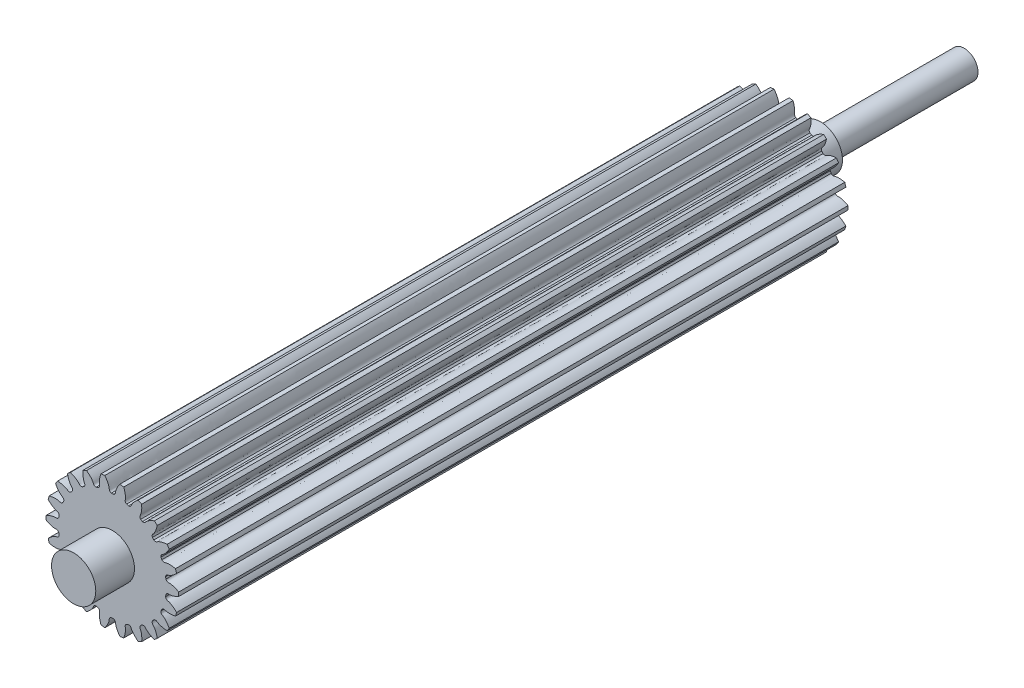
from build123d import *
from build123d.topology import SkipClean

# Parameters (mm, degrees)
SKETCH_1_R               = 12
EXTRUDE_1_DEPTH          = 30
CUT_EXTRUDE_1_DEPTH      = 35.467375879
PATTERN_CIRCULAR_1_COUNT = 22
EXTRUDE_START            = 91
EXTRUDE_2_DEPTH          = 91
SKETCH_19_R              = 4
EXTRUDE_3_DEPTH          = 7
EXTRUDE_START_2          = 7
SKETCH_20_R              = 4
EXTRUDE_4_DEPTH          = 7
SKETCH_21_R              = 2.5
EXTRUDE_5_DEPTH          = 26


with BuildPart() as part:
    # 草图1 → 凸台-拉伸1 (new body)
    with BuildSketch(Plane.XY):
        Circle(SKETCH_1_R)
    extrude(amount=EXTRUDE_1_DEPTH)

    # 草图2 → 切除-拉伸1 (cut, through all)
    with BuildSketch(Plane.XY):
        with BuildLine():
            ThreePointArc((0.185665431, 9.748232063), (0, 9.75), (-0.185665431, 9.748232063))
            add(Edge.make_bspline(
                [(-0.185665431, 9.748232063), (-0.588158706, 9.876186429), (-0.548347264, 10.151774696), (-0.599584047, 10.42157039), (-0.60596118, 10.451918903), (-0.613876897, 10.486162213), (-0.623483721, 10.524250431), (-0.634939934, 10.566127653), (-0.648399943, 10.611733662), (-0.664017171, 10.661003439), (-0.681942991, 10.713867378), (-0.70232689, 10.77025128), (-0.72531626, 10.830076418), (-0.751056303, 10.893259589), (-0.779689902, 10.959713172), (-0.811357505, 11.029345185), (-0.846197011, 11.10205935), (-0.884343649, 11.177755162), (-0.925929868, 11.25632795), (-0.971085225, 11.337668957), (-1.019936271, 11.421665408), (-1.072606448, 11.508200591), (-1.129215979, 11.597153935), (-1.189881763, 11.688401095), (-1.254717274, 11.781814033), (-1.323832459, 11.877261111), (-1.397333644, 11.974607178), (-1.475323431, 12.073713662), (-1.557900608, 12.174438668), (-1.64516006, 12.276637076), (-1.737192673, 12.380160638), (-1.834085256, 12.484858081), (-1.935920447, 12.590575215), (-2.042776642, 12.697155033), (-2.154727905, 12.804437827), (-2.271843904, 12.912261294), (-2.394189822, 13.020460649), (-2.521826308, 13.128868741), (-2.654809363, 13.237316171), (-2.841488127, 13.383435539), (-2.986445715, 13.489968103), (-3.085558798, 13.559868128)],
                knots=[0, 0, 0, 0, 0.157021319, 0.162530984, 0.168888289, 0.176093235, 0.184145822, 0.19304605, 0.202793918, 0.213389427, 0.224832576, 0.237123367, 0.250261798, 0.264247869, 0.279081582, 0.294762935, 0.311291928, 0.328668563, 0.346892838, 0.365964754, 0.38588431, 0.406651508, 0.428266346, 0.450728824, 0.474038944, 0.498196704, 0.523202104, 0.549055146, 0.575755828, 0.603304151, 0.631700114, 0.660943719, 0.691034964, 0.721973849, 0.753760376, 0.786394543, 0.819876351, 0.854205799, 0.889382888, 0.925407618, 1, 1, 1, 1], degree=3))
            ThreePointArc((-3.085558798, 13.559868128), (0, 13.906498364), (3.085558798, 13.559868128))
            add(Edge.make_bspline(
                [(0.185665431, 9.748232063), (0.588158706, 9.876186429), (0.548347264, 10.151774696), (0.599584047, 10.42157039), (0.60596118, 10.451918903), (0.613876897, 10.486162213), (0.623483721, 10.524250431), (0.634939934, 10.566127653), (0.648399943, 10.611733662), (0.664017171, 10.661003439), (0.681942991, 10.713867378), (0.70232689, 10.77025128), (0.72531626, 10.830076418), (0.751056303, 10.893259589), (0.779689902, 10.959713172), (0.811357505, 11.029345185), (0.846197011, 11.10205935), (0.884343649, 11.177755162), (0.925929868, 11.25632795), (0.971085225, 11.337668957), (1.019936271, 11.421665408), (1.072606448, 11.508200591), (1.129215979, 11.597153935), (1.189881763, 11.688401095), (1.254717274, 11.781814033), (1.323832459, 11.877261111), (1.397333644, 11.974607178), (1.475323431, 12.073713662), (1.557900608, 12.174438668), (1.64516006, 12.276637076), (1.737192673, 12.380160638), (1.834085256, 12.484858081), (1.935920447, 12.590575215), (2.042776642, 12.697155033), (2.154727905, 12.804437827), (2.271843904, 12.912261294), (2.394189822, 13.020460649), (2.521826308, 13.128868741), (2.654809363, 13.237316171), (2.841488127, 13.383435539), (2.986445715, 13.489968103), (3.085558798, 13.559868128)],
                knots=[0, 0, 0, 0, 0.157021319, 0.162530984, 0.168888289, 0.176093235, 0.184145822, 0.19304605, 0.202793918, 0.213389427, 0.224832576, 0.237123367, 0.250261798, 0.264247869, 0.279081582, 0.294762935, 0.311291928, 0.328668563, 0.346892838, 0.365964754, 0.38588431, 0.406651508, 0.428266346, 0.450728824, 0.474038944, 0.498196704, 0.523202104, 0.549055146, 0.575755828, 0.603304151, 0.631700114, 0.660943719, 0.691034964, 0.721973849, 0.753760376, 0.786394543, 0.819876351, 0.854205799, 0.889382888, 0.925407618, 1, 1, 1, 1], degree=3))
        make_face()
    cut_extrude_1 = extrude(amount=CUT_EXTRUDE_1_DEPTH, mode=Mode.SUBTRACT)

    # 阵列(圆周)1: 切除-拉伸1 ×22 about axis
    pattern_circular_1_axis = Axis((0, 0, -1.5), (0, 0, 1))
    for i in range(1, PATTERN_CIRCULAR_1_COUNT):
        add(cut_extrude_1.rotate(pattern_circular_1_axis, i * 360 / PATTERN_CIRCULAR_1_COUNT), mode=Mode.SUBTRACT)

    # 草图4 → 凸台-拉伸2 (add)
    with BuildSketch(Plane(origin=(0, 0, 0), x_dir=(-1, 0, 0), z_dir=(0, 0, -1)).offset(EXTRUDE_START)):
        with BuildLine():
            ThreePointArc((2.924539021, 9.301052173), (2.746892429, 9.355056493), (2.568249667, 9.405668166))
            add(Edge.make_bspline(
                [(2.568249667, 9.405668166), (2.218109108, 9.641834941), (2.333950094, 9.895043767), (2.361944393, 10.180005258), (2.365849304, 10.238460497), (2.368085913, 10.32113962), (2.366834845, 10.420382901), (2.360772595, 10.536017252), (2.34858845, 10.667790208), (2.32898426, 10.815370787), (2.300679804, 10.978350119), (2.26241667, 11.156242389), (2.212962422, 11.348485973), (2.151114634, 11.554444777), (2.096274933, 11.713680077), (2.062581682, 11.80433527), (2.055688884, 11.822611522)],
                knots=[0, 0, 0, 0, 0.157021319, 0.162530984, 0.176093235, 0.19304605, 0.213389427, 0.237123367, 0.264247869, 0.294762935, 0.328668563, 0.365964754, 0.406651508, 0.450728824, 0.498196704, 0.510209942, 0.510209942, 0.510209942, 0.510209942], degree=3))
            ThreePointArc((2.055688884, 11.822611522), (1.707778059, 11.877857303), (1.358395532, 11.922867171))
            add(Edge.make_bspline(
                [(1.358395532, 11.922867171), (1.300155371, 11.845656586), (1.201946581, 11.708817962), (1.073915974, 11.512256119), (0.972303664, 11.341732625), (0.885472389, 11.181826213), (0.812397844, 11.033422979), (0.752009469, 10.897343589), (0.703194045, 10.774341044), (0.670055832, 10.680054419), (0.644027119, 10.597938124), (0.627360159, 10.539619361), (0.611348785, 10.476138997), (0.60176986, 10.433080149), (0.548347264, 10.151774696), (0.588158706, 9.876186429), (0.185665431, 9.748232063)],
                knots=[0.489790058, 0.489790058, 0.489790058, 0.489790058, 0.549271176, 0.593348492, 0.634035246, 0.671331437, 0.705237065, 0.735752131, 0.762876633, 0.786610573, 0.797206082, 0.815854178, 0.823906765, 0.837469016, 0.842978681, 1, 1, 1, 1], degree=3))
            ThreePointArc((0.185665431, 9.748232063), (0, 9.75), (-0.185665431, 9.748232063))
            add(Edge.make_bspline(
                [(-0.185665431, 9.748232063), (-0.588158706, 9.876186429), (-0.548347264, 10.151774696), (-0.60176986, 10.433080149), (-0.61449187, 10.490267681), (-0.635639261, 10.570227844), (-0.664799714, 10.665098608), (-0.703194362, 10.774341023), (-0.752009695, 10.897343577), (-0.812398032, 11.033422968), (-0.885472542, 11.181826205), (-0.972303795, 11.341732617), (-1.073916075, 11.512256114), (-1.191283893, 11.692447604), (-1.288763969, 11.829782626), (-1.346632927, 11.907273161), (-1.358395532, 11.922867171)],
                knots=[0, 0, 0, 0, 0.157021319, 0.162530984, 0.176093235, 0.19304605, 0.213389427, 0.237123367, 0.264247869, 0.294762935, 0.328668563, 0.365964754, 0.406651508, 0.450728824, 0.498196704, 0.510209942, 0.510209942, 0.510209942, 0.510209942], degree=3))
            ThreePointArc((-1.358395532, 11.922867171), (-1.707778059, 11.877857303), (-2.055688884, 11.822611522))
            add(Edge.make_bspline(
                [(-2.055688884, 11.822611522), (-2.089817174, 11.732120359), (-2.145495923, 11.573156047), (-2.21296252, 11.34848595), (-2.262416797, 11.156242359), (-2.300679954, 10.978350084), (-2.328984444, 10.815370745), (-2.348588671, 10.667790156), (-2.360772906, 10.536017183), (-2.366005176, 10.436213716), (-2.36784471, 10.350090571), (-2.367406247, 10.289438503), (-2.364884562, 10.224018615), (-2.361944393, 10.180005258), (-2.333950094, 9.895043767), (-2.218109108, 9.641834941), (-2.568249667, 9.405668166)],
                knots=[0.489790058, 0.489790058, 0.489790058, 0.489790058, 0.549271176, 0.593348492, 0.634035246, 0.671331437, 0.705237065, 0.735752131, 0.762876633, 0.786610573, 0.797206082, 0.815854178, 0.823906765, 0.837469016, 0.842978681, 1, 1, 1, 1], degree=3))
            ThreePointArc((-2.568249667, 9.405668166), (-2.746892429, 9.355056493), (-2.924539021, 9.301052173))
            add(Edge.make_bspline(
                [(-2.924539021, 9.301052173), (-3.3467774, 9.310428028), (-3.386220788, 9.586069213), (-3.516732299, 9.840928935), (-3.545050567, 9.892215766), (-3.587868721, 9.962979072), (-3.642576155, 10.045791454), (-3.710192695, 10.139791761), (-3.791684488, 10.244058979), (-3.887964667, 10.357612838), (-3.999889169, 10.479417233), (-4.128253989, 10.608383121), (-4.273792278, 10.74337173), (-4.437171685, 10.883197863), (-4.569394878, 10.987506541), (-4.646751344, 11.045554595), (-4.662430821, 11.057203029)],
                knots=[0, 0, 0, 0, 0.157021319, 0.162530984, 0.176093235, 0.19304605, 0.213389427, 0.237123367, 0.264247869, 0.294762935, 0.328668563, 0.365964754, 0.406651508, 0.450728824, 0.498196704, 0.510209942, 0.510209942, 0.510209942, 0.510209942], degree=3))
            ThreePointArc((-4.662430821, 11.057203029), (-4.984980156, 10.915583944), (-5.303233613, 10.7645582))
            add(Edge.make_bspline(
                [(-5.303233613, 10.7645582), (-5.310485161, 10.668117515), (-5.319123107, 10.499905858), (-5.320559952, 10.265328941), (-5.313849705, 10.066939687), (-5.300444889, 9.885473322), (-5.281686262, 9.721121495), (-5.258918124, 9.573995807), (-5.233484075, 9.44412787), (-5.210386516, 9.346893044), (-5.187887842, 9.263740235), (-5.170379477, 9.205668531), (-5.149529026, 9.143609049), (-5.134307959, 9.102206883), (-5.027164697, 8.83667524), (-4.844678915, 8.626359328), (-5.114100451, 8.301112972)],
                knots=[0.489790058, 0.489790058, 0.489790058, 0.489790058, 0.549271176, 0.593348492, 0.634035246, 0.671331437, 0.705237065, 0.735752131, 0.762876633, 0.786610573, 0.797206082, 0.815854178, 0.823906765, 0.837469016, 0.842978681, 1, 1, 1, 1], degree=3))
            ThreePointArc((-5.114100451, 8.301112972), (-5.27124797, 8.202221945), (-5.426483851, 8.100356351))
            add(Edge.make_bspline(
                [(-5.426483851, 8.100356351), (-5.834260094, 7.99039412), (-5.949762843, 8.243757414), (-6.146790001, 8.451524185), (-6.188410351, 8.49275536), (-6.249430396, 8.548588987), (-6.325252738, 8.612634021), (-6.41661328, 8.683776874), (-6.524179553, 8.760861647), (-6.648551527, 8.842690515), (-6.790258564, 8.928028199), (-6.949757596, 9.015605514), (-7.127431248, 9.104123262), (-7.323586215, 9.192256156), (-7.479840591, 9.255088021), (-7.570417602, 9.288990887), (-7.588743694, 9.295750058)],
                knots=[0, 0, 0, 0, 0.157021319, 0.162530984, 0.176093235, 0.19304605, 0.213389427, 0.237123367, 0.264247869, 0.294762935, 0.328668563, 0.365964754, 0.406651508, 0.450728824, 0.498196704, 0.510209942, 0.510209942, 0.510209942, 0.510209942], degree=3))
            ThreePointArc((-7.588743694, 9.295750058), (-7.858328807, 9.068994892), (-8.121141894, 8.834424392))
            add(Edge.make_bspline(
                [(-8.121141894, 8.834424392), (-8.100929222, 8.739847235), (-8.061826571, 8.576015742), (-7.997117259, 8.350536032), (-7.934786112, 8.162073431), (-7.870799303, 7.991734302), (-7.806497272, 7.839324794), (-7.743201307, 7.704573257), (-7.68220949, 7.587131484), (-7.632653327, 7.500342686), (-7.587639155, 7.426896759), (-7.554479312, 7.376110043), (-7.516989274, 7.322438657), (-7.49072043, 7.287001839), (-7.313108313, 7.06241184), (-7.078761648, 6.912027385), (-7.245637231, 6.524050974)],
                knots=[0.489790058, 0.489790058, 0.489790058, 0.489790058, 0.549271176, 0.593348492, 0.634035246, 0.671331437, 0.705237065, 0.735752131, 0.762876633, 0.786610573, 0.797206082, 0.815854178, 0.823906765, 0.837469016, 0.842978681, 1, 1, 1, 1], degree=3))
            ThreePointArc((-7.245637231, 6.524050974), (-7.36855835, 6.384892156), (-7.488807233, 6.243417832))
            add(Edge.make_bspline(
                [(-7.488807233, 6.243417832), (-7.849085732, 6.023026001), (-8.031290497, 6.233585417), (-8.278871334, 6.377427208), (-8.330421932, 6.405262424), (-8.404700387, 6.441643063), (-8.495494963, 6.481732201), (-8.603198018, 6.52425403), (-8.728124391, 6.567911406), (-8.870512283, 6.611385996), (-9.030521594, 6.653343419), (-9.208233175, 6.692437167), (-9.403648127, 6.727312872), (-9.616687345, 6.756612524), (-9.784314102, 6.772877312), (-9.88077365, 6.77988838), (-9.900261685, 6.781210701)],
                knots=[0, 0, 0, 0, 0.157021319, 0.162530984, 0.176093235, 0.19304605, 0.213389427, 0.237123367, 0.264247869, 0.294762935, 0.328668563, 0.365964754, 0.406651508, 0.450728824, 0.498196704, 0.510209942, 0.510209942, 0.510209942, 0.510209942], degree=3))
            ThreePointArc((-9.900261685, 6.781210701), (-10.095042394, 6.487689809), (-10.281123557, 6.188578059))
            add(Edge.make_bspline(
                [(-10.281123557, 6.188578059), (-10.235084176, 6.103526509), (-10.151408791, 5.957347833), (-10.025795686, 5.759232356), (-9.912893339, 5.595964528), (-9.803508366, 5.450552498), (-9.698872299, 5.322432622), (-9.60017637, 5.210972003), (-9.508567979, 5.115470827), (-9.43656796, 5.046159169), (-9.372685068, 4.988370276), (-9.326560161, 4.948982987), (-9.275467756, 4.908047833), (-9.240279279, 4.881447244), (-9.006587387, 4.715993833), (-8.739365211, 4.637724091), (-8.790175575, 4.218449166)],
                knots=[0.489790058, 0.489790058, 0.489790058, 0.489790058, 0.549271176, 0.593348492, 0.634035246, 0.671331437, 0.705237065, 0.735752131, 0.762876633, 0.786610573, 0.797206082, 0.815854178, 0.823906765, 0.837469016, 0.842978681, 1, 1, 1, 1], degree=3))
            ThreePointArc((-8.790175575, 4.218449166), (-8.868911955, 4.050296377), (-8.94443199, 3.880674732))
            add(Edge.make_bspline(
                [(-8.94443199, 3.880674732), (-9.228025124, 3.567708136), (-9.462170759, 3.718405401), (-9.740247748, 3.786669007), (-9.797552271, 3.798853219), (-9.879071537, 3.812833528), (-9.97748271, 3.825718986), (-10.092802818, 3.836174925), (-10.2249685, 3.842868044), (-10.373836889, 3.844466303), (-10.53918547, 3.839644323), (-10.720712465, 3.827087362), (-10.91803736, 3.805495601), (-11.130701659, 3.773588328), (-11.296120675, 3.741968363), (-11.390648179, 3.721519639), (-11.409719353, 3.717297982)],
                knots=[0, 0, 0, 0, 0.157021319, 0.162530984, 0.176093235, 0.19304605, 0.213389427, 0.237123367, 0.264247869, 0.294762935, 0.328668563, 0.365964754, 0.406651508, 0.450728824, 0.498196704, 0.510209942, 0.510209942, 0.510209942, 0.510209942], degree=3))
            ThreePointArc((-11.409719353, 3.717297982), (-11.513915683, 3.380790682), (-11.608189734, 3.041369937))
            add(Edge.make_bspline(
                [(-11.608189734, 3.041369937), (-11.540053481, 2.972734366), (-11.418584245, 2.856051033), (-11.242243773, 2.701349926), (-11.087916901, 2.576503859), (-10.941995486, 2.467799346), (-10.805502374, 2.374348612), (-10.679402238, 2.295208787), (-10.564598841, 2.229385146), (-10.475987977, 2.183165848), (-10.398411779, 2.145715701), (-10.343058573, 2.120918762), (-10.282503004, 2.096036163), (-10.241245656, 2.080426825), (-9.970406315, 1.987514054), (-9.69195738, 1.987699973), (-9.62258617, 1.571093695)],
                knots=[0.489790058, 0.489790058, 0.489790058, 0.489790058, 0.549271176, 0.593348492, 0.634035246, 0.671331437, 0.705237065, 0.735752131, 0.762876633, 0.786610573, 0.797206082, 0.815854178, 0.823906765, 0.837469016, 0.842978681, 1, 1, 1, 1], degree=3))
            ThreePointArc((-9.62258617, 1.571093695), (-9.650759058, 1.387569673), (-9.675432062, 1.203542444))
            add(Edge.make_bspline(
                [(-9.675432062, 1.203542444), (-9.859364802, 0.823355776), (-10.126482219, 0.901982294), (-10.412527217, 0.889137403), (-10.470943193, 0.88468352), (-10.553099064, 0.875130897), (-10.651154146, 0.859768772), (-10.764748758, 0.837311742), (-10.893446471, 0.806498368), (-11.036734926, 0.766090814), (-11.194027219, 0.71488008), (-11.36466339, 0.651689699), (-11.547912138, 0.575379709), (-11.742972721, 0.484850449), (-11.892782731, 0.407907392), (-11.977720136, 0.361655509), (-11.994829415, 0.352231889)],
                knots=[0, 0, 0, 0, 0.157021319, 0.162530984, 0.176093235, 0.19304605, 0.213389427, 0.237123367, 0.264247869, 0.294762935, 0.328668563, 0.365964754, 0.406651508, 0.450728824, 0.498196704, 0.510209942, 0.510209942, 0.510209942, 0.510209942], degree=3))
            ThreePointArc((-11.994829415, 0.352231889), (-12, 0), (-11.994829415, -0.352231889))
            add(Edge.make_bspline(
                [(-11.994829415, -0.352231889), (-11.910116284, -0.398891037), (-11.760693911, -0.476626036), (-11.547912129, -0.57537981), (-11.364663379, -0.651689829), (-11.194027205, -0.714880233), (-11.03673491, -0.766091002), (-10.89344645, -0.806498594), (-10.764748734, -0.83731206), (-10.666705752, -0.856694587), (-10.58172101, -0.870771999), (-10.521623893, -0.878969688), (-10.456511011, -0.885783891), (-10.412527217, -0.889137403), (-10.126482219, -0.901982294), (-9.859364802, -0.823355776), (-9.675432062, -1.203542444)],
                knots=[0.489790058, 0.489790058, 0.489790058, 0.489790058, 0.549271176, 0.593348492, 0.634035246, 0.671331437, 0.705237065, 0.735752131, 0.762876633, 0.786610573, 0.797206082, 0.815854178, 0.823906765, 0.837469016, 0.842978681, 1, 1, 1, 1], degree=3))
            ThreePointArc((-9.675432062, -1.203542444), (-9.650759058, -1.387569673), (-9.62258617, -1.571093695))
            add(Edge.make_bspline(
                [(-9.62258617, -1.571093695), (-9.69195738, -1.987699973), (-9.970406315, -1.987514054), (-10.241245656, -2.080426825), (-10.296040571, -2.101157977), (-10.372177267, -2.133469636), (-10.461932418, -2.175834796), (-10.564598775, -2.229385458), (-10.679402194, -2.29520901), (-10.805502337, -2.374348797), (-10.941995455, -2.467799496), (-11.087916875, -2.576503987), (-11.242243753, -2.701350024), (-11.403897972, -2.843167131), (-11.52596226, -2.959199811), (-11.594428442, -3.027507799), (-11.608189734, -3.041369937)],
                knots=[0, 0, 0, 0, 0.157021319, 0.162530984, 0.176093235, 0.19304605, 0.213389427, 0.237123367, 0.264247869, 0.294762935, 0.328668563, 0.365964754, 0.406651508, 0.450728824, 0.498196704, 0.510209942, 0.510209942, 0.510209942, 0.510209942], degree=3))
            ThreePointArc((-11.608189734, -3.041369937), (-11.513915683, -3.380790682), (-11.409719353, -3.717297982))
            add(Edge.make_bspline(
                [(-11.409719353, -3.717297982), (-11.315292297, -3.73820066), (-11.150022101, -3.770689699), (-10.918037323, -3.805495695), (-10.720712418, -3.827087483), (-10.539185414, -3.839644466), (-10.373836821, -3.844466479), (-10.224968417, -3.842868255), (-10.092802706, -3.836175223), (-9.993270464, -3.827150722), (-9.907762136, -3.816714931), (-9.847789818, -3.807649241), (-9.783394683, -3.795843002), (-9.740247748, -3.786669007), (-9.462170759, -3.718405401), (-9.228025124, -3.567708136), (-8.94443199, -3.880674732)],
                knots=[0.489790058, 0.489790058, 0.489790058, 0.489790058, 0.549271176, 0.593348492, 0.634035246, 0.671331437, 0.705237065, 0.735752131, 0.762876633, 0.786610573, 0.797206082, 0.815854178, 0.823906765, 0.837469016, 0.842978681, 1, 1, 1, 1], degree=3))
            ThreePointArc((-8.94443199, -3.880674732), (-8.868911955, -4.050296377), (-8.790175575, -4.218449166))
            add(Edge.make_bspline(
                [(-8.790175575, -4.218449166), (-8.739365211, -4.637724091), (-9.006587387, -4.715993833), (-9.240279279, -4.881447244), (-9.287013975, -4.916776151), (-9.350963354, -4.969229146), (-9.425147146, -5.035165168), (-9.508567828, -5.115471107), (-9.600176265, -5.210972204), (-9.698872211, -5.322432789), (-9.803508295, -5.450552634), (-9.912893278, -5.595964644), (-10.02579564, -5.759232445), (-10.14094723, -5.940848218), (-10.225376874, -6.086570243), (-10.27182511, -6.171400431), (-10.281123557, -6.188578059)],
                knots=[0, 0, 0, 0, 0.157021319, 0.162530984, 0.176093235, 0.19304605, 0.213389427, 0.237123367, 0.264247869, 0.294762935, 0.328668563, 0.365964754, 0.406651508, 0.450728824, 0.498196704, 0.510209942, 0.510209942, 0.510209942, 0.510209942], degree=3))
            ThreePointArc((-10.281123557, -6.188578059), (-10.095042394, -6.487689809), (-9.900261685, -6.781210701))
            add(Edge.make_bspline(
                [(-9.900261685, -6.781210701), (-9.803770624, -6.774663498), (-9.636041811, -6.759274507), (-9.403648065, -6.727312951), (-9.208233095, -6.69243727), (-9.0305215, -6.65334354), (-8.870512168, -6.611386145), (-8.728124252, -6.567911585), (-8.603197826, -6.524254284), (-8.510239836, -6.487553866), (-8.431135298, -6.453450317), (-8.37614638, -6.427855698), (-8.317685902, -6.398385488), (-8.278871334, -6.377427208), (-8.031290497, -6.233585417), (-7.849085732, -6.023026001), (-7.488807233, -6.243417832)],
                knots=[0.489790058, 0.489790058, 0.489790058, 0.489790058, 0.549271176, 0.593348492, 0.634035246, 0.671331437, 0.705237065, 0.735752131, 0.762876633, 0.786610573, 0.797206082, 0.815854178, 0.823906765, 0.837469016, 0.842978681, 1, 1, 1, 1], degree=3))
            ThreePointArc((-7.488807233, -6.243417832), (-7.36855835, -6.384892156), (-7.245637231, -6.524050974))
            add(Edge.make_bspline(
                [(-7.245637231, -6.524050974), (-7.078761648, -6.912027385), (-7.313108313, -7.06241184), (-7.49072043, -7.287001839), (-7.525608738, -7.334066362), (-7.572190001, -7.402411265), (-7.624792505, -7.486576403), (-7.682209266, -7.58713171), (-7.743201149, -7.70457342), (-7.80649714, -7.83932493), (-7.870799196, -7.991734412), (-7.934786021, -8.162073525), (-7.997117189, -8.350536104), (-8.056437255, -8.557237115), (-8.096392266, -8.720842953), (-8.117059596, -8.815322902), (-8.121141894, -8.834424392)],
                knots=[0, 0, 0, 0, 0.157021319, 0.162530984, 0.176093235, 0.19304605, 0.213389427, 0.237123367, 0.264247869, 0.294762935, 0.328668563, 0.365964754, 0.406651508, 0.450728824, 0.498196704, 0.510209942, 0.510209942, 0.510209942, 0.510209942], degree=3))
            ThreePointArc((-8.121141894, -8.834424392), (-7.858328807, -9.068994892), (-7.588743694, -9.295750058))
            add(Edge.make_bspline(
                [(-7.588743694, -9.295750058), (-7.498005759, -9.262283389), (-7.341406722, -9.200263094), (-7.127431166, -9.104123321), (-6.94975749, -9.015605591), (-6.79025844, -8.928028289), (-6.648551375, -8.842690626), (-6.524179369, -8.760861779), (-6.416613024, -8.683777064), (-6.337760188, -8.622373978), (-6.271468019, -8.56736554), (-6.225917377, -8.527315513), (-6.178127677, -8.482568835), (-6.146790001, -8.451524185), (-5.949762843, -8.243757414), (-5.834260094, -7.99039412), (-5.426483851, -8.100356351)],
                knots=[0.489790058, 0.489790058, 0.489790058, 0.489790058, 0.549271176, 0.593348492, 0.634035246, 0.671331437, 0.705237065, 0.735752131, 0.762876633, 0.786610573, 0.797206082, 0.815854178, 0.823906765, 0.837469016, 0.842978681, 1, 1, 1, 1], degree=3))
            ThreePointArc((-5.426483851, -8.100356351), (-5.27124797, -8.202221945), (-5.114100451, -8.301112972))
            add(Edge.make_bspline(
                [(-5.114100451, -8.301112972), (-4.844678915, -8.626359328), (-5.027164697, -8.83667524), (-5.134307959, -9.102206883), (-5.154523438, -9.157194134), (-5.179962849, -9.235894046), (-5.206722521, -9.331469743), (-5.233483796, -9.444128024), (-5.258917927, -9.573995919), (-5.281686098, -9.721121587), (-5.300444756, -9.885473397), (-5.313849591, -10.066939751), (-5.320559864, -10.265328991), (-5.319242647, -10.480369552), (-5.311486107, -10.648604832), (-5.304698188, -10.745080339), (-5.303233613, -10.7645582)],
                knots=[0, 0, 0, 0, 0.157021319, 0.162530984, 0.176093235, 0.19304605, 0.213389427, 0.237123367, 0.264247869, 0.294762935, 0.328668563, 0.365964754, 0.406651508, 0.450728824, 0.498196704, 0.510209942, 0.510209942, 0.510209942, 0.510209942], degree=3))
            ThreePointArc((-5.303233613, -10.7645582), (-4.984980156, -10.915583944), (-4.662430821, -11.057203029))
            add(Edge.make_bspline(
                [(-4.662430821, -11.057203029), (-4.584797061, -10.999528165), (-4.452014522, -10.89590108), (-4.273792183, -10.743371764), (-4.128253866, -10.608383165), (-3.999889025, -10.479417284), (-3.887964489, -10.357612901), (-3.791684274, -10.244059055), (-3.710192396, -10.139791871), (-3.651832902, -10.05866063), (-3.6037237, -9.987203758), (-3.571301575, -9.93594294), (-3.538054289, -9.879544902), (-3.516732299, -9.840928935), (-3.386220788, -9.586069213), (-3.3467774, -9.310428028), (-2.924539021, -9.301052173)],
                knots=[0.489790058, 0.489790058, 0.489790058, 0.489790058, 0.549271176, 0.593348492, 0.634035246, 0.671331437, 0.705237065, 0.735752131, 0.762876633, 0.786610573, 0.797206082, 0.815854178, 0.823906765, 0.837469016, 0.842978681, 1, 1, 1, 1], degree=3))
            ThreePointArc((-2.924539021, -9.301052173), (-2.746892429, -9.355056493), (-2.568249667, -9.405668166))
            add(Edge.make_bspline(
                [(-2.568249667, -9.405668166), (-2.218109108, -9.641834941), (-2.333950094, -9.895043767), (-2.361944393, -10.180005258), (-2.365849304, -10.238460497), (-2.368085913, -10.32113962), (-2.366834845, -10.420382901), (-2.360772595, -10.536017252), (-2.34858845, -10.667790208), (-2.32898426, -10.815370787), (-2.300679804, -10.978350119), (-2.26241667, -11.156242389), (-2.212962422, -11.348485973), (-2.151114634, -11.554444777), (-2.096274933, -11.713680077), (-2.062581682, -11.80433527), (-2.055688884, -11.822611522)],
                knots=[0, 0, 0, 0, 0.157021319, 0.162530984, 0.176093235, 0.19304605, 0.213389427, 0.237123367, 0.264247869, 0.294762935, 0.328668563, 0.365964754, 0.406651508, 0.450728824, 0.498196704, 0.510209942, 0.510209942, 0.510209942, 0.510209942], degree=3))
            ThreePointArc((-2.055688884, -11.822611522), (-1.707778059, -11.877857303), (-1.358395532, -11.922867171))
            add(Edge.make_bspline(
                [(-1.358395532, -11.922867171), (-1.300155371, -11.845656586), (-1.201946581, -11.708817962), (-1.073915974, -11.512256119), (-0.972303664, -11.341732625), (-0.885472389, -11.181826213), (-0.812397844, -11.033422979), (-0.752009469, -10.897343589), (-0.703194045, -10.774341044), (-0.670055832, -10.680054419), (-0.644027119, -10.597938124), (-0.627360159, -10.539619361), (-0.611348785, -10.476138997), (-0.60176986, -10.433080149), (-0.548347264, -10.151774696), (-0.588158706, -9.876186429), (-0.185665431, -9.748232063)],
                knots=[0.489790058, 0.489790058, 0.489790058, 0.489790058, 0.549271176, 0.593348492, 0.634035246, 0.671331437, 0.705237065, 0.735752131, 0.762876633, 0.786610573, 0.797206082, 0.815854178, 0.823906765, 0.837469016, 0.842978681, 1, 1, 1, 1], degree=3))
            ThreePointArc((-0.185665431, -9.748232063), (0, -9.75), (0.185665431, -9.748232063))
            add(Edge.make_bspline(
                [(0.185665431, -9.748232063), (0.588158706, -9.876186429), (0.548347264, -10.151774696), (0.60176986, -10.433080149), (0.61449187, -10.490267681), (0.635639261, -10.570227844), (0.664799714, -10.665098608), (0.703194362, -10.774341023), (0.752009695, -10.897343577), (0.812398032, -11.033422968), (0.885472542, -11.181826205), (0.972303795, -11.341732617), (1.073916075, -11.512256114), (1.191283893, -11.692447604), (1.288763969, -11.829782626), (1.346632927, -11.907273161), (1.358395532, -11.922867171)],
                knots=[0, 0, 0, 0, 0.157021319, 0.162530984, 0.176093235, 0.19304605, 0.213389427, 0.237123367, 0.264247869, 0.294762935, 0.328668563, 0.365964754, 0.406651508, 0.450728824, 0.498196704, 0.510209942, 0.510209942, 0.510209942, 0.510209942], degree=3))
            ThreePointArc((1.358395532, -11.922867171), (1.707778059, -11.877857303), (2.055688884, -11.822611522))
            add(Edge.make_bspline(
                [(2.055688884, -11.822611522), (2.089817174, -11.732120359), (2.145495923, -11.573156047), (2.21296252, -11.34848595), (2.262416797, -11.156242359), (2.300679954, -10.978350084), (2.328984444, -10.815370745), (2.348588671, -10.667790156), (2.360772906, -10.536017183), (2.366005176, -10.436213716), (2.36784471, -10.350090571), (2.367406247, -10.289438503), (2.364884562, -10.224018615), (2.361944393, -10.180005258), (2.333950094, -9.895043767), (2.218109108, -9.641834941), (2.568249667, -9.405668166)],
                knots=[0.489790058, 0.489790058, 0.489790058, 0.489790058, 0.549271176, 0.593348492, 0.634035246, 0.671331437, 0.705237065, 0.735752131, 0.762876633, 0.786610573, 0.797206082, 0.815854178, 0.823906765, 0.837469016, 0.842978681, 1, 1, 1, 1], degree=3))
            ThreePointArc((2.568249667, -9.405668166), (2.746892429, -9.355056493), (2.924539021, -9.301052173))
            add(Edge.make_bspline(
                [(2.924539021, -9.301052173), (3.3467774, -9.310428028), (3.386220788, -9.586069213), (3.516732299, -9.840928935), (3.545050567, -9.892215766), (3.587868721, -9.962979072), (3.642576155, -10.045791454), (3.710192695, -10.139791761), (3.791684488, -10.244058979), (3.887964667, -10.357612838), (3.999889169, -10.479417233), (4.128253989, -10.608383121), (4.273792278, -10.74337173), (4.437171685, -10.883197863), (4.569394878, -10.987506541), (4.646751344, -11.045554595), (4.662430821, -11.057203029)],
                knots=[0, 0, 0, 0, 0.157021319, 0.162530984, 0.176093235, 0.19304605, 0.213389427, 0.237123367, 0.264247869, 0.294762935, 0.328668563, 0.365964754, 0.406651508, 0.450728824, 0.498196704, 0.510209942, 0.510209942, 0.510209942, 0.510209942], degree=3))
            ThreePointArc((4.662430821, -11.057203029), (4.984980156, -10.915583944), (5.303233613, -10.7645582))
            add(Edge.make_bspline(
                [(5.303233613, -10.7645582), (5.310485161, -10.668117515), (5.319123107, -10.499905858), (5.320559952, -10.265328941), (5.313849705, -10.066939687), (5.300444889, -9.885473322), (5.281686262, -9.721121495), (5.258918124, -9.573995807), (5.233484075, -9.44412787), (5.210386516, -9.346893044), (5.187887842, -9.263740235), (5.170379477, -9.205668531), (5.149529026, -9.143609049), (5.134307959, -9.102206883), (5.027164697, -8.83667524), (4.844678915, -8.626359328), (5.114100451, -8.301112972)],
                knots=[0.489790058, 0.489790058, 0.489790058, 0.489790058, 0.549271176, 0.593348492, 0.634035246, 0.671331437, 0.705237065, 0.735752131, 0.762876633, 0.786610573, 0.797206082, 0.815854178, 0.823906765, 0.837469016, 0.842978681, 1, 1, 1, 1], degree=3))
            ThreePointArc((5.114100451, -8.301112972), (5.27124797, -8.202221945), (5.426483851, -8.100356351))
            add(Edge.make_bspline(
                [(5.426483851, -8.100356351), (5.834260094, -7.99039412), (5.949762843, -8.243757414), (6.146790001, -8.451524185), (6.188410351, -8.49275536), (6.249430396, -8.548588987), (6.325252738, -8.612634021), (6.41661328, -8.683776874), (6.524179553, -8.760861647), (6.648551527, -8.842690515), (6.790258564, -8.928028199), (6.949757596, -9.015605514), (7.127431248, -9.104123262), (7.323586215, -9.192256156), (7.479840591, -9.255088021), (7.570417602, -9.288990887), (7.588743694, -9.295750058)],
                knots=[0, 0, 0, 0, 0.157021319, 0.162530984, 0.176093235, 0.19304605, 0.213389427, 0.237123367, 0.264247869, 0.294762935, 0.328668563, 0.365964754, 0.406651508, 0.450728824, 0.498196704, 0.510209942, 0.510209942, 0.510209942, 0.510209942], degree=3))
            ThreePointArc((7.588743694, -9.295750058), (7.858328807, -9.068994892), (8.121141894, -8.834424392))
            add(Edge.make_bspline(
                [(8.121141894, -8.834424392), (8.100929222, -8.739847235), (8.061826571, -8.576015742), (7.997117259, -8.350536032), (7.934786112, -8.162073431), (7.870799303, -7.991734302), (7.806497272, -7.839324794), (7.743201307, -7.704573257), (7.68220949, -7.587131484), (7.632653327, -7.500342686), (7.587639155, -7.426896759), (7.554479312, -7.376110043), (7.516989274, -7.322438657), (7.49072043, -7.287001839), (7.313108313, -7.06241184), (7.078761648, -6.912027385), (7.245637231, -6.524050974)],
                knots=[0.489790058, 0.489790058, 0.489790058, 0.489790058, 0.549271176, 0.593348492, 0.634035246, 0.671331437, 0.705237065, 0.735752131, 0.762876633, 0.786610573, 0.797206082, 0.815854178, 0.823906765, 0.837469016, 0.842978681, 1, 1, 1, 1], degree=3))
            ThreePointArc((7.245637231, -6.524050974), (7.36855835, -6.384892156), (7.488807233, -6.243417832))
            add(Edge.make_bspline(
                [(7.488807233, -6.243417832), (7.849085732, -6.023026001), (8.031290497, -6.233585417), (8.278871334, -6.377427208), (8.330421932, -6.405262424), (8.404700387, -6.441643063), (8.495494963, -6.481732201), (8.603198018, -6.52425403), (8.728124391, -6.567911406), (8.870512283, -6.611385996), (9.030521594, -6.653343419), (9.208233175, -6.692437167), (9.403648127, -6.727312872), (9.616687345, -6.756612524), (9.784314102, -6.772877312), (9.88077365, -6.77988838), (9.900261685, -6.781210701)],
                knots=[0, 0, 0, 0, 0.157021319, 0.162530984, 0.176093235, 0.19304605, 0.213389427, 0.237123367, 0.264247869, 0.294762935, 0.328668563, 0.365964754, 0.406651508, 0.450728824, 0.498196704, 0.510209942, 0.510209942, 0.510209942, 0.510209942], degree=3))
            ThreePointArc((9.900261685, -6.781210701), (10.095042394, -6.487689809), (10.281123557, -6.188578059))
            add(Edge.make_bspline(
                [(10.281123557, -6.188578059), (10.235084176, -6.103526509), (10.151408791, -5.957347833), (10.025795686, -5.759232356), (9.912893339, -5.595964528), (9.803508366, -5.450552498), (9.698872299, -5.322432622), (9.60017637, -5.210972003), (9.508567979, -5.115470827), (9.43656796, -5.046159169), (9.372685068, -4.988370276), (9.326560161, -4.948982987), (9.275467756, -4.908047833), (9.240279279, -4.881447244), (9.006587387, -4.715993833), (8.739365211, -4.637724091), (8.790175575, -4.218449166)],
                knots=[0.489790058, 0.489790058, 0.489790058, 0.489790058, 0.549271176, 0.593348492, 0.634035246, 0.671331437, 0.705237065, 0.735752131, 0.762876633, 0.786610573, 0.797206082, 0.815854178, 0.823906765, 0.837469016, 0.842978681, 1, 1, 1, 1], degree=3))
            ThreePointArc((8.790175575, -4.218449166), (8.868911955, -4.050296377), (8.94443199, -3.880674732))
            add(Edge.make_bspline(
                [(8.94443199, -3.880674732), (9.228025124, -3.567708136), (9.462170759, -3.718405401), (9.740247748, -3.786669007), (9.797552271, -3.798853219), (9.879071537, -3.812833528), (9.97748271, -3.825718986), (10.092802818, -3.836174925), (10.2249685, -3.842868044), (10.373836889, -3.844466303), (10.53918547, -3.839644323), (10.720712465, -3.827087362), (10.91803736, -3.805495601), (11.130701659, -3.773588328), (11.296120675, -3.741968363), (11.390648179, -3.721519639), (11.409719353, -3.717297982)],
                knots=[0, 0, 0, 0, 0.157021319, 0.162530984, 0.176093235, 0.19304605, 0.213389427, 0.237123367, 0.264247869, 0.294762935, 0.328668563, 0.365964754, 0.406651508, 0.450728824, 0.498196704, 0.510209942, 0.510209942, 0.510209942, 0.510209942], degree=3))
            ThreePointArc((11.409719353, -3.717297982), (11.513915683, -3.380790682), (11.608189734, -3.041369937))
            add(Edge.make_bspline(
                [(11.608189734, -3.041369937), (11.540053481, -2.972734366), (11.418584245, -2.856051033), (11.242243773, -2.701349926), (11.087916901, -2.576503859), (10.941995486, -2.467799346), (10.805502374, -2.374348612), (10.679402238, -2.295208787), (10.564598841, -2.229385146), (10.475987977, -2.183165848), (10.398411779, -2.145715701), (10.343058573, -2.120918762), (10.282503004, -2.096036163), (10.241245656, -2.080426825), (9.970406315, -1.987514054), (9.69195738, -1.987699973), (9.62258617, -1.571093695)],
                knots=[0.489790058, 0.489790058, 0.489790058, 0.489790058, 0.549271176, 0.593348492, 0.634035246, 0.671331437, 0.705237065, 0.735752131, 0.762876633, 0.786610573, 0.797206082, 0.815854178, 0.823906765, 0.837469016, 0.842978681, 1, 1, 1, 1], degree=3))
            ThreePointArc((9.62258617, -1.571093695), (9.650759058, -1.387569673), (9.675432062, -1.203542444))
            add(Edge.make_bspline(
                [(9.675432062, -1.203542444), (9.859364802, -0.823355776), (10.126482219, -0.901982294), (10.412527217, -0.889137403), (10.470943193, -0.88468352), (10.553099064, -0.875130897), (10.651154146, -0.859768772), (10.764748758, -0.837311742), (10.893446471, -0.806498368), (11.036734926, -0.766090814), (11.194027219, -0.71488008), (11.36466339, -0.651689699), (11.547912138, -0.575379709), (11.742972721, -0.484850449), (11.892782731, -0.407907392), (11.977720136, -0.361655509), (11.994829415, -0.352231889)],
                knots=[0, 0, 0, 0, 0.157021319, 0.162530984, 0.176093235, 0.19304605, 0.213389427, 0.237123367, 0.264247869, 0.294762935, 0.328668563, 0.365964754, 0.406651508, 0.450728824, 0.498196704, 0.510209942, 0.510209942, 0.510209942, 0.510209942], degree=3))
            ThreePointArc((11.994829415, -0.352231889), (12, 0), (11.994829415, 0.352231889))
            add(Edge.make_bspline(
                [(11.994829415, 0.352231889), (11.910116284, 0.398891037), (11.760693911, 0.476626036), (11.547912129, 0.57537981), (11.364663379, 0.651689829), (11.194027205, 0.714880233), (11.03673491, 0.766091002), (10.89344645, 0.806498594), (10.764748734, 0.83731206), (10.666705752, 0.856694587), (10.58172101, 0.870771999), (10.521623893, 0.878969688), (10.456511011, 0.885783891), (10.412527217, 0.889137403), (10.126482219, 0.901982294), (9.859364802, 0.823355776), (9.675432062, 1.203542444)],
                knots=[0.489790058, 0.489790058, 0.489790058, 0.489790058, 0.549271176, 0.593348492, 0.634035246, 0.671331437, 0.705237065, 0.735752131, 0.762876633, 0.786610573, 0.797206082, 0.815854178, 0.823906765, 0.837469016, 0.842978681, 1, 1, 1, 1], degree=3))
            ThreePointArc((9.675432062, 1.203542444), (9.650759058, 1.387569673), (9.62258617, 1.571093695))
            add(Edge.make_bspline(
                [(9.62258617, 1.571093695), (9.69195738, 1.987699973), (9.970406315, 1.987514054), (10.241245656, 2.080426825), (10.296040571, 2.101157977), (10.372177267, 2.133469636), (10.461932418, 2.175834796), (10.564598775, 2.229385458), (10.679402194, 2.29520901), (10.805502337, 2.374348797), (10.941995455, 2.467799496), (11.087916875, 2.576503987), (11.242243753, 2.701350024), (11.403897972, 2.843167131), (11.52596226, 2.959199811), (11.594428442, 3.027507799), (11.608189734, 3.041369937)],
                knots=[0, 0, 0, 0, 0.157021319, 0.162530984, 0.176093235, 0.19304605, 0.213389427, 0.237123367, 0.264247869, 0.294762935, 0.328668563, 0.365964754, 0.406651508, 0.450728824, 0.498196704, 0.510209942, 0.510209942, 0.510209942, 0.510209942], degree=3))
            ThreePointArc((11.608189734, 3.041369937), (11.513915683, 3.380790682), (11.409719353, 3.717297982))
            add(Edge.make_bspline(
                [(11.409719353, 3.717297982), (11.315292297, 3.73820066), (11.150022101, 3.770689699), (10.918037323, 3.805495695), (10.720712418, 3.827087483), (10.539185414, 3.839644466), (10.373836821, 3.844466479), (10.224968417, 3.842868255), (10.092802706, 3.836175223), (9.993270464, 3.827150722), (9.907762136, 3.816714931), (9.847789818, 3.807649241), (9.783394683, 3.795843002), (9.740247748, 3.786669007), (9.462170759, 3.718405401), (9.228025124, 3.567708136), (8.94443199, 3.880674732)],
                knots=[0.489790058, 0.489790058, 0.489790058, 0.489790058, 0.549271176, 0.593348492, 0.634035246, 0.671331437, 0.705237065, 0.735752131, 0.762876633, 0.786610573, 0.797206082, 0.815854178, 0.823906765, 0.837469016, 0.842978681, 1, 1, 1, 1], degree=3))
            ThreePointArc((8.94443199, 3.880674732), (8.868911955, 4.050296377), (8.790175575, 4.218449166))
            add(Edge.make_bspline(
                [(8.790175575, 4.218449166), (8.739365211, 4.637724091), (9.006587387, 4.715993833), (9.240279279, 4.881447244), (9.287013975, 4.916776151), (9.350963354, 4.969229146), (9.425147146, 5.035165168), (9.508567828, 5.115471107), (9.600176265, 5.210972204), (9.698872211, 5.322432789), (9.803508295, 5.450552634), (9.912893278, 5.595964644), (10.02579564, 5.759232445), (10.14094723, 5.940848218), (10.225376874, 6.086570243), (10.27182511, 6.171400431), (10.281123557, 6.188578059)],
                knots=[0, 0, 0, 0, 0.157021319, 0.162530984, 0.176093235, 0.19304605, 0.213389427, 0.237123367, 0.264247869, 0.294762935, 0.328668563, 0.365964754, 0.406651508, 0.450728824, 0.498196704, 0.510209942, 0.510209942, 0.510209942, 0.510209942], degree=3))
            ThreePointArc((10.281123557, 6.188578059), (10.095042394, 6.487689809), (9.900261685, 6.781210701))
            add(Edge.make_bspline(
                [(9.900261685, 6.781210701), (9.803770624, 6.774663498), (9.636041811, 6.759274507), (9.403648065, 6.727312951), (9.208233095, 6.69243727), (9.0305215, 6.65334354), (8.870512168, 6.611386145), (8.728124252, 6.567911585), (8.603197826, 6.524254284), (8.510239836, 6.487553866), (8.431135298, 6.453450317), (8.37614638, 6.427855698), (8.317685902, 6.398385488), (8.278871334, 6.377427208), (8.031290497, 6.233585417), (7.849085732, 6.023026001), (7.488807233, 6.243417832)],
                knots=[0.489790058, 0.489790058, 0.489790058, 0.489790058, 0.549271176, 0.593348492, 0.634035246, 0.671331437, 0.705237065, 0.735752131, 0.762876633, 0.786610573, 0.797206082, 0.815854178, 0.823906765, 0.837469016, 0.842978681, 1, 1, 1, 1], degree=3))
            ThreePointArc((7.488807233, 6.243417832), (7.36855835, 6.384892156), (7.245637231, 6.524050974))
            add(Edge.make_bspline(
                [(7.245637231, 6.524050974), (7.078761648, 6.912027385), (7.313108313, 7.06241184), (7.49072043, 7.287001839), (7.525608738, 7.334066362), (7.572190001, 7.402411265), (7.624792505, 7.486576403), (7.682209266, 7.58713171), (7.743201149, 7.70457342), (7.80649714, 7.83932493), (7.870799196, 7.991734412), (7.934786021, 8.162073525), (7.997117189, 8.350536104), (8.056437255, 8.557237115), (8.096392266, 8.720842953), (8.117059596, 8.815322902), (8.121141894, 8.834424392)],
                knots=[0, 0, 0, 0, 0.157021319, 0.162530984, 0.176093235, 0.19304605, 0.213389427, 0.237123367, 0.264247869, 0.294762935, 0.328668563, 0.365964754, 0.406651508, 0.450728824, 0.498196704, 0.510209942, 0.510209942, 0.510209942, 0.510209942], degree=3))
            ThreePointArc((8.121141894, 8.834424392), (7.858328807, 9.068994892), (7.588743694, 9.295750058))
            add(Edge.make_bspline(
                [(7.588743694, 9.295750058), (7.498005759, 9.262283389), (7.341406722, 9.200263094), (7.127431166, 9.104123321), (6.94975749, 9.015605591), (6.79025844, 8.928028289), (6.648551375, 8.842690626), (6.524179369, 8.760861779), (6.416613024, 8.683777064), (6.337760188, 8.622373978), (6.271468019, 8.56736554), (6.225917377, 8.527315513), (6.178127677, 8.482568835), (6.146790001, 8.451524185), (5.949762843, 8.243757414), (5.834260094, 7.99039412), (5.426483851, 8.100356351)],
                knots=[0.489790058, 0.489790058, 0.489790058, 0.489790058, 0.549271176, 0.593348492, 0.634035246, 0.671331437, 0.705237065, 0.735752131, 0.762876633, 0.786610573, 0.797206082, 0.815854178, 0.823906765, 0.837469016, 0.842978681, 1, 1, 1, 1], degree=3))
            ThreePointArc((5.426483851, 8.100356351), (5.27124797, 8.202221945), (5.114100451, 8.301112972))
            add(Edge.make_bspline(
                [(5.114100451, 8.301112972), (4.844678915, 8.626359328), (5.027164697, 8.83667524), (5.134307959, 9.102206883), (5.154523438, 9.157194134), (5.179962849, 9.235894046), (5.206722521, 9.331469743), (5.233483796, 9.444128024), (5.258917927, 9.573995919), (5.281686098, 9.721121587), (5.300444756, 9.885473397), (5.313849591, 10.066939751), (5.320559864, 10.265328991), (5.319242647, 10.480369552), (5.311486107, 10.648604832), (5.304698188, 10.745080339), (5.303233613, 10.7645582)],
                knots=[0, 0, 0, 0, 0.157021319, 0.162530984, 0.176093235, 0.19304605, 0.213389427, 0.237123367, 0.264247869, 0.294762935, 0.328668563, 0.365964754, 0.406651508, 0.450728824, 0.498196704, 0.510209942, 0.510209942, 0.510209942, 0.510209942], degree=3))
            ThreePointArc((5.303233613, 10.7645582), (4.984980156, 10.915583944), (4.662430821, 11.057203029))
            add(Edge.make_bspline(
                [(4.662430821, 11.057203029), (4.584797061, 10.999528165), (4.452014522, 10.89590108), (4.273792183, 10.743371764), (4.128253866, 10.608383165), (3.999889025, 10.479417284), (3.887964489, 10.357612901), (3.791684274, 10.244059055), (3.710192396, 10.139791871), (3.651832902, 10.05866063), (3.6037237, 9.987203758), (3.571301575, 9.93594294), (3.538054289, 9.879544902), (3.516732299, 9.840928935), (3.386220788, 9.586069213), (3.3467774, 9.310428028), (2.924539021, 9.301052173)],
                knots=[0.489790058, 0.489790058, 0.489790058, 0.489790058, 0.549271176, 0.593348492, 0.634035246, 0.671331437, 0.705237065, 0.735752131, 0.762876633, 0.786610573, 0.797206082, 0.815854178, 0.823906765, 0.837469016, 0.842978681, 1, 1, 1, 1], degree=3))
        make_face()
    extrude(amount=-EXTRUDE_2_DEPTH)

    # 草图19 → 凸台-拉伸3 (add)
    with SkipClean():  # the faces are left unmerged after this step: merging them gives an invalid solid
        with BuildSketch(Plane(origin=(0, 0, -91), x_dir=(-1, 0, 0), z_dir=(0, 0, -1))):
            Circle(SKETCH_19_R)
        extrude(amount=EXTRUDE_3_DEPTH)

    # 草图20 → 凸台-拉伸4 (add)
    with SkipClean():  # the faces are left unmerged after this step: merging them gives an invalid solid
        with BuildSketch(Plane.XY.offset(30).offset(EXTRUDE_START_2)):
            Circle(SKETCH_20_R)
        extrude(amount=-EXTRUDE_4_DEPTH)

    # 草图21 → 凸台-拉伸5 (add)
    with SkipClean():  # the faces are left unmerged after this step: merging them gives an invalid solid
        with BuildSketch(Plane(origin=(0, 0, -98), x_dir=(-1, 0, 0), z_dir=(0, 0, -1))):
            Circle(SKETCH_21_R)
        extrude(amount=EXTRUDE_5_DEPTH)


solid = part.part
